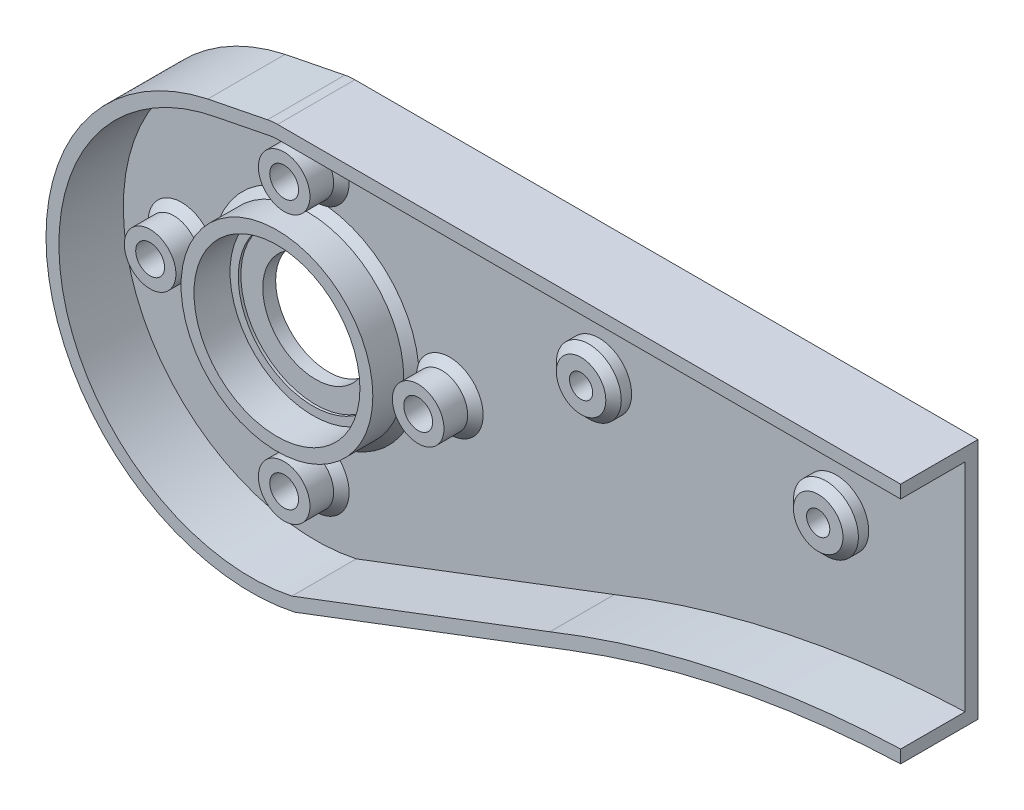
from build123d import *

# Parameters (mm, degrees)
ESTRUSIONE_ESTRUSIONE1_DEPTH = 2.5
ESTRUSIONE_ESTRUSIONE2_DEPTH = 15
SCHIZZO2_R                   = 10.25
SCHIZZO2_R_2                 = 2.8
TAGLIO_ESTRUSIONE1_DEPTH     = 15
SCHIZZO3_R                   = 16.1
SCHIZZO3_R_2                 = 14.5
ESTRUSIONE_ESTRUSIONE3_DEPTH = 0.5
SCHIZZO3_3_R                 = 18.6
SCHIZZO3_3_R_2               = 16.1
ESTRUSIONE_ESTRUSIONE4_DEPTH = 7.5
SCHIZZO3_4_R                 = 5
SCHIZZO3_4_R_2               = 2.8
ESTRUSIONE_ESTRUSIONE5_DEPTH = 6.1
SCHIZZO3_5_R                 = 6.3
SCHIZZO3_5_R_2               = 2.25
ESTRUSIONE_ESTRUSIONE6_DEPTH = 3.5
SMUSSO1_SIZE                 = 1.5
FORO_PER_VITE_M4_1_D         = 4.5
FORO_PER_VITE_M4_1_DEPTH     = 50
FORO_PER_VITE_M4_1_TIP       = 1.351936393


with BuildPart() as part:
    # Schizzo1 → Estrusione-Estrusione1 (new body)
    with BuildSketch(Plane.XY):
        with BuildLine():
            Line((5.123487201, 41.4), (126, 41.4))
            Line((126, 41.4), (126, -5.6))
            ThreePointArc((126, -5.6), (93.463092461, -9.435358059), (61.98889523, -18.531249019))
            Line((61.98889523, -18.531249019), (8.416056083, -38.9))
            ThreePointArc((8.416056083, -38.9), (-38.9, -8.416056083), (-8.416056083, 38.9))
            Line((-8.416056083, 38.9), (3.170362201, 41.207410603))
            ThreePointArc((3.170362201, 41.207410603), (4.142188579, 41.351736181), (5.123487201, 41.4))
        make_face()
    extrude(amount=ESTRUSIONE_ESTRUSIONE1_DEPTH)

    # Schizzo1<3> → Estrusione-Estrusione2 (add)
    with BuildSketch(Plane.XY):
        with BuildLine():
            Line((126, 41.4), (5.123487201, 41.4))
            ThreePointArc((5.123487201, 41.4), (4.142188579, 41.351736181), (3.170362201, 41.207410603))
            Line((3.170362201, 41.207410603), (-8.416056083, 38.9))
            ThreePointArc((-8.416056083, 38.9), (-38.9, -8.416056083), (8.416056083, -38.9))
            Line((8.416056083, -38.9), (61.98889523, -18.531249019))
            ThreePointArc((61.98889523, -18.531249019), (93.463092461, -9.435358059), (126, -5.6))
            Line((126, -5.6), (126, -3.098457484))
            ThreePointArc((126, -3.098457484), (91.357291517, -7.317073844), (57.953366675, -17.421121553))
            Line((57.953366675, -17.421121553), (7.887409345, -36.456532663))
            ThreePointArc((7.887409345, -36.456532663), (-36.58362067, -7.275211244), (-6.660968885, 36.700429065))
            Line((-6.660968885, 36.700429065), (3.41687663, 38.707410603))
            ThreePointArc((3.41687663, 38.707410603), (4.388703008, 38.851736181), (5.37000163, 38.9))
            Line((5.37000163, 38.9), (126, 38.9))
            Line((126, 38.9), (126, 41.4))
        make_face()
    extrude(amount=ESTRUSIONE_ESTRUSIONE2_DEPTH)

    # Schizzo2 → Taglio-Estrusione1 (cut)
    with BuildSketch(Plane(origin=(0, 0, 0), x_dir=(-1, 0, 0), z_dir=(0, 0, -1))):
        Circle(SCHIZZO2_R)
        with Locations((0, -26)):
            Circle(SCHIZZO2_R_2)
        with Locations((26, 0)):
            Circle(SCHIZZO2_R_2)
        with Locations((0, 26)):
            Circle(SCHIZZO2_R_2)
    extrude(amount=-TAGLIO_ESTRUSIONE1_DEPTH, mode=Mode.SUBTRACT)

    # Schizzo3 → Estrusione-Estrusione3 (add)
    with BuildSketch(Plane.XY.offset(2.5)):
        Circle(SCHIZZO3_R)
        Circle(SCHIZZO3_R_2, mode=Mode.SUBTRACT)
    extrude(amount=ESTRUSIONE_ESTRUSIONE3_DEPTH)

    # Schizzo3<3> → Estrusione-Estrusione4 (add)
    with BuildSketch(Plane.XY.offset(2.5)):
        Circle(SCHIZZO3_3_R)
        Circle(SCHIZZO3_3_R_2, mode=Mode.SUBTRACT)
    extrude(amount=ESTRUSIONE_ESTRUSIONE4_DEPTH)

    # Schizzo3<4> → Estrusione-Estrusione5 (add)
    # profile 1 of 4: a face of its own
    with BuildSketch(Plane.XY.offset(2.5)):
        with Locations((-26, 0)):
            Circle(SCHIZZO3_4_R)
        with Locations(Location((-26, 0, 0), (0, 0, 180))):
            Circle(SCHIZZO3_4_R_2, mode=Mode.SUBTRACT)
    # profile 2 of 4: a face of its own
    with BuildSketch(Plane.XY.offset(2.5)):
        with Locations((0, -26)):
            Circle(SCHIZZO3_4_R)
        with Locations(Location((0, -26, 0), (0, 0, 180))):
            Circle(SCHIZZO3_4_R_2, mode=Mode.SUBTRACT)
    # profile 3 of 4: a face of its own
    with BuildSketch(Plane.XY.offset(2.5)):
        with Locations((26, 0)):
            Circle(SCHIZZO3_4_R)
        with Locations((26, 0)):
            Circle(SCHIZZO3_4_R_2, mode=Mode.SUBTRACT)
    # profile 4 of 4: a face of its own
    with BuildSketch(Plane.XY.offset(2.5)):
        with Locations((0, 26)):
            Circle(SCHIZZO3_4_R)
        with Locations(Location((0, 26, 0), (0, 0, 180))):
            Circle(SCHIZZO3_4_R_2, mode=Mode.SUBTRACT)
    extrude(amount=ESTRUSIONE_ESTRUSIONE5_DEPTH)

    # Schizzo3<5> → Estrusione-Estrusione6 (add)
    # profile 1 of 2: a face of its own
    with BuildSketch(Plane.XY.offset(2.5)):
        with Locations((55, 17.9)):
            Circle(SCHIZZO3_5_R)
        with Locations((55, 17.9)):
            Circle(SCHIZZO3_5_R_2, mode=Mode.SUBTRACT)
    # profile 2 of 2: a face of its own
    with BuildSketch(Plane.XY.offset(2.5)):
        with Locations((101, 17.9)):
            Circle(SCHIZZO3_5_R)
        with Locations((101, 17.9)):
            Circle(SCHIZZO3_5_R_2, mode=Mode.SUBTRACT)
    extrude(amount=ESTRUSIONE_ESTRUSIONE6_DEPTH)

    # Smusso1
    # the kernel refuses this chamfer: 1.5 mm, written as the material it adds along each edge
    with BuildSketch(Plane(origin=(0, 0, 2.5), x_dir=(1, 0, 0), z_dir=(0, -1, 0))) as smusso1_piece_1:
        Polygon((18.6 + SMUSSO1_SIZE, 0), (18.6, SMUSSO1_SIZE), (18.6, 0), align=None)
    revolve(axis=Axis((0, 0, 2.5), (0, 0, 1)))
    with BuildSketch(Plane(origin=(-26, 0, 2.5), x_dir=(1, 0, 0), z_dir=(0, -1, 0))) as smusso1_piece_2:
        Polygon((5 + SMUSSO1_SIZE, 0), (5, SMUSSO1_SIZE), (5, 0), align=None)
    revolve(axis=Axis((-26, 0, 2.5), (0, 0, 1)))
    with BuildSketch(Plane(origin=(0, -26, 2.5), x_dir=(1, 0, 0), z_dir=(0, -1, 0))) as smusso1_piece_3:
        Polygon((5 + SMUSSO1_SIZE, 0), (5, SMUSSO1_SIZE), (5, 0), align=None)
    revolve(axis=Axis((0, -26, 2.5), (0, 0, 1)))
    with BuildSketch(Plane(origin=(26, 0, 2.5), x_dir=(1, 0, 0), z_dir=(0, -1, 0))) as smusso1_piece_4:
        Polygon((5 + SMUSSO1_SIZE, 0), (5, SMUSSO1_SIZE), (5, 0), align=None)
    revolve(axis=Axis((26, 0, 2.5), (0, 0, 1)))
    with BuildSketch(Plane(origin=(0, 26, 2.5), x_dir=(1, 0, 0), z_dir=(0, -1, 0))) as smusso1_piece_5:
        Polygon((5 + SMUSSO1_SIZE, 0), (5, SMUSSO1_SIZE), (5, 0), align=None)
    revolve(axis=Axis((0, 26, 2.5), (0, 0, 1)))
    # the kernel refuses this chamfer: 1.5 mm, written as the material it takes off along each edge
    with BuildSketch(Plane(origin=(55, 17.9, 6), x_dir=(1, 0, 0), z_dir=(0, -1, 0))) as smusso1_2_piece_1:
        Polygon((6.3, -SMUSSO1_SIZE), (6.3 - SMUSSO1_SIZE, 0), (6.3, 0), align=None)
    revolve(axis=Axis((55, 17.9, 6), (0, 0, 1)), mode=Mode.SUBTRACT)
    with BuildSketch(Plane(origin=(101, 17.9, 6), x_dir=(1, 0, 0), z_dir=(0, -1, 0))) as smusso1_2_piece_2:
        Polygon((6.3, -SMUSSO1_SIZE), (6.3 - SMUSSO1_SIZE, 0), (6.3, 0), align=None)
    revolve(axis=Axis((101, 17.9, 6), (0, 0, 1)), mode=Mode.SUBTRACT)

    # Foro per Vite M4-1
    with Locations(Plane(origin=(55, 17.9, 0), x_dir=(-1, 0, 0), z_dir=(0, 0, -1))):
        with Locations((0, 0), (-46, 0)):
            Hole(FORO_PER_VITE_M4_1_D / 2, depth=FORO_PER_VITE_M4_1_DEPTH)
            with Locations((0, 0, -(FORO_PER_VITE_M4_1_DEPTH + FORO_PER_VITE_M4_1_TIP / 2))):  # 118° drill point
                Cone(0, FORO_PER_VITE_M4_1_D / 2, FORO_PER_VITE_M4_1_TIP, mode=Mode.SUBTRACT)


solid = part.part
